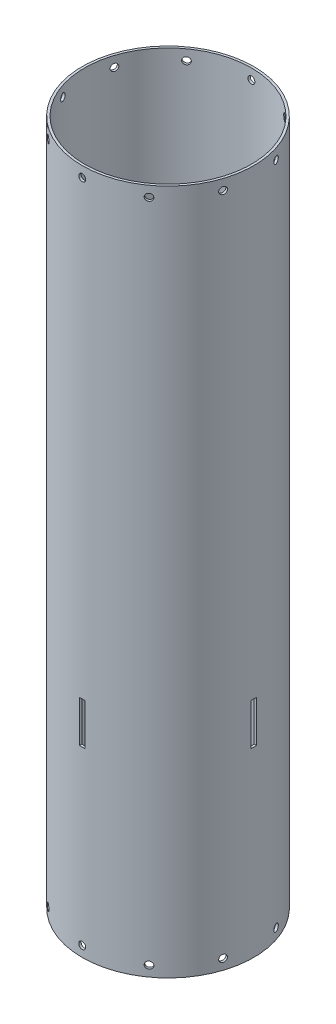
from build123d import *

# Parameters (mm, degrees)
SKETCH1_R           = 78.359
SKETCH1_R_2         = 76.2
BOSS_EXTRUDE1_DEPTH = 626.11
SKETCH2_R           = 3.175
CUT_EXTRUDE1_DEPTH  = 636.841173456
CIRPATTERN1_COUNT   = 10
SKETCH3_W           = 5.08
SKETCH3_H           = 38.1
CUT_EXTRUDE2_DEPTH  = 636.841173579
CIRPATTERN2_COUNT   = 4


with BuildPart() as part:
    # Sketch1 → Boss-Extrude1 (new body)
    with BuildSketch(Plane(origin=(0, 0, 0), x_dir=(1, 0, 0), z_dir=(0, 1, 0))):
        Circle(SKETCH1_R)
        Circle(SKETCH1_R_2, mode=Mode.SUBTRACT)
    extrude(amount=BOSS_EXTRUDE1_DEPTH)

    # Sketch2 → Cut-Extrude1 (cut, through all)
    with BuildSketch(Plane.XY):
        with Locations((0, 9.525)):
            Circle(SKETCH2_R)
        with Locations((0, 616.585)):
            Circle(SKETCH2_R)
    cut_extrude1 = extrude(amount=-CUT_EXTRUDE1_DEPTH, mode=Mode.SUBTRACT)

    # CirPattern1: Cut-Extrude1 ×10 about axis
    cirpattern1_axis = Axis((0, 0, 0), (0, 1, 0))
    for i in range(1, CIRPATTERN1_COUNT):
        add(cut_extrude1.rotate(cirpattern1_axis, i * 360 / CIRPATTERN1_COUNT), mode=Mode.SUBTRACT)

    # Sketch3 → Cut-Extrude2 (cut, through all)
    with BuildSketch(Plane.XY):
        with Locations((0, 185.42)):
            Rectangle(SKETCH3_W, SKETCH3_H)
    cut_extrude2 = extrude(amount=-CUT_EXTRUDE2_DEPTH, mode=Mode.SUBTRACT)

    # CirPattern2: Cut-Extrude2 ×4 about axis
    cirpattern2_axis = Axis((0, 626.11, 0), (0, -1, 0))
    for i in range(1, CIRPATTERN2_COUNT):
        add(cut_extrude2.rotate(cirpattern2_axis, i * 360 / CIRPATTERN2_COUNT), mode=Mode.SUBTRACT)


solid = part.part
